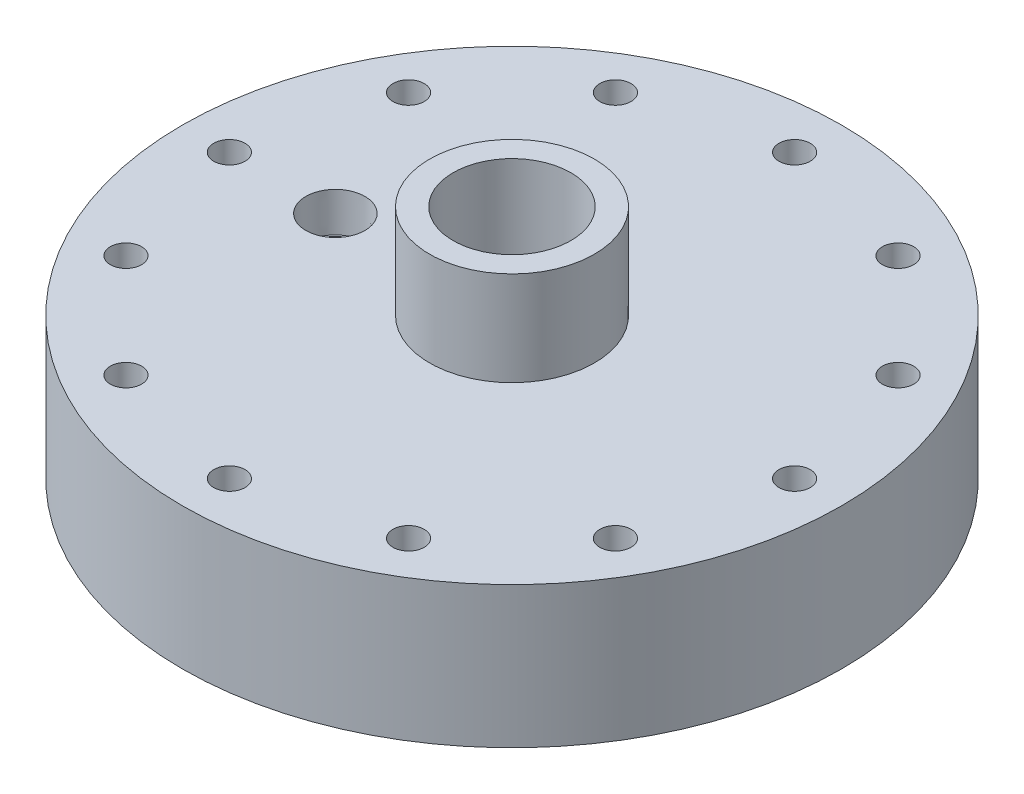
from build123d import *

# Parameters (mm, degrees)
F_5_16_CLEARANCE_HOLE1_D = 8.4328
CIRPATTERN1_COUNT        = 12


with BuildPart() as part:
    # Sketch1 → Revolve1 (revolve)
    with BuildSketch(Plane.XY):
        Polygon((-62.2935, 0), (-88.9, 0), (-88.9, 38.1), (-22.225, 38.1), (-22.225, 63.5), (-15.875, 63.5), (-15.875, 31.75), (-31.75, 31.75), (-31.75, 19.05), (-38.1, 19.05), (-38.1, 12.7), (-57.15, 12.7), (-57.15, 0), (-58.7375, 0), (-58.7375, 2.54), (-62.2935, 2.54), align=None)
    revolve(axis=Axis((0, 0, 0), (0, 1, 0)))

    # Sketch3 → 3/8 NPT Tapped Hole1 (revolve, cut)
    with BuildSketch(Plane(origin=(-47.625, 38.1, 0), x_dir=(0, 0, 1), z_dir=(1, 0, 0))):
        Polygon((0, 0), (0, 29.688582582), (7.1374, 25.4), (7.1374, 10.414), (7.653732494, 10.414), (7.9655416, 0), align=None)
    revolve(axis=Axis((-47.625, 44.45, 0), (0, -1, 0)), mode=Mode.SUBTRACT)

    # 5/16 Clearance Hole1 (through all)
    with Locations(Plane(origin=(0, 38.1, 0), x_dir=(1, 0, 0), z_dir=(0, 1, 0))):
        with Locations((-76.2, 0)):
            f_5_16_clearance_hole1 = Hole(F_5_16_CLEARANCE_HOLE1_D / 2)

    # CirPattern1: 5/16 Clearance Hole1 ×12 about axis
    cirpattern1_axis = Axis((0, 0, 0), (0, -1, 0))
    for i in range(1, CIRPATTERN1_COUNT):
        add(f_5_16_clearance_hole1.rotate(cirpattern1_axis, i * 360 / CIRPATTERN1_COUNT), mode=Mode.SUBTRACT)


solid = part.part
